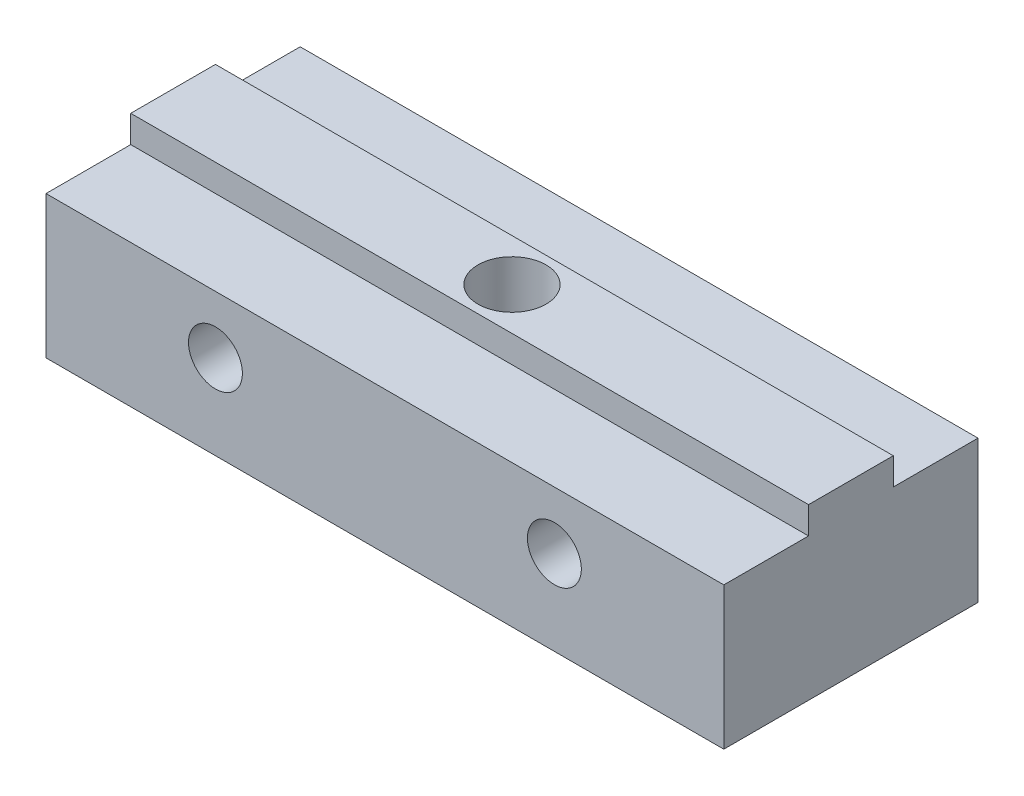
from build123d import *

# Parameters (mm, degrees)
SKETCH1_W                                           = 50.8
SKETCH1_H                                           = 19.05
BOSS_EXTRUDE1_DEPTH                                 = 12.7
F_10_32_TAPPED_HOLE1_D                              = 4.0386
CBORE_FOR_10_BINDING_HEAD_MACHINE_SCREW_D           = 5.1054
CBORE_FOR_10_BINDING_HEAD_MACHINE_SCREW_CBORE_D     = 11.1125
CBORE_FOR_10_BINDING_HEAD_MACHINE_SCREW_CBORE_DEPTH = 2.54
SKETCH2_OUTSIDE_W                                   = 63.944
SKETCH2_OUTSIDE_H                                   = 32.194
SKETCH2_OUTSIDE_W_2                                 = 50.8
SKETCH2_OUTSIDE_H_2                                 = 6.35
CUT_EXTRUDE1_DEPTH                                  = 2.032


with BuildPart() as part:
    # Sketch1 → Boss-Extrude1 (new body)
    with BuildSketch(Plane(origin=(0, 0, 0), x_dir=(1, 0, 0), z_dir=(0, 1, 0))):
        Rectangle(SKETCH1_W, SKETCH1_H)
    extrude(amount=BOSS_EXTRUDE1_DEPTH)

    # #10-32 Tapped Hole1 (through all)
    with Locations(Plane(origin=(0, 0, -9.525), x_dir=(-1, 0, 0), z_dir=(0, 0, -1))):
        with Locations((12.7, 6.35), (-12.7, 6.35)):
            Hole(F_10_32_TAPPED_HOLE1_D / 2)

    # CBORE for #10 Binding Head Machine Screw1 (through all)
    with Locations(Plane(origin=(0, 0, 0), x_dir=(-1, 0, 0), z_dir=(0, -1, 0))):
        with Locations((0, 0)):
            CounterBoreHole(CBORE_FOR_10_BINDING_HEAD_MACHINE_SCREW_D / 2, CBORE_FOR_10_BINDING_HEAD_MACHINE_SCREW_CBORE_D / 2, CBORE_FOR_10_BINDING_HEAD_MACHINE_SCREW_CBORE_DEPTH)

    # Sketch2 outside → Cut-Extrude1 (cut)
    with BuildSketch(Plane(origin=(0, 12.7, 0), x_dir=(1, 0, 0), z_dir=(0, 1, 0))):
        Rectangle(SKETCH2_OUTSIDE_W, SKETCH2_OUTSIDE_H)
        Rectangle(SKETCH2_OUTSIDE_W_2, SKETCH2_OUTSIDE_H_2, mode=Mode.SUBTRACT)
    extrude(amount=-CUT_EXTRUDE1_DEPTH, mode=Mode.SUBTRACT)


solid = part.part
